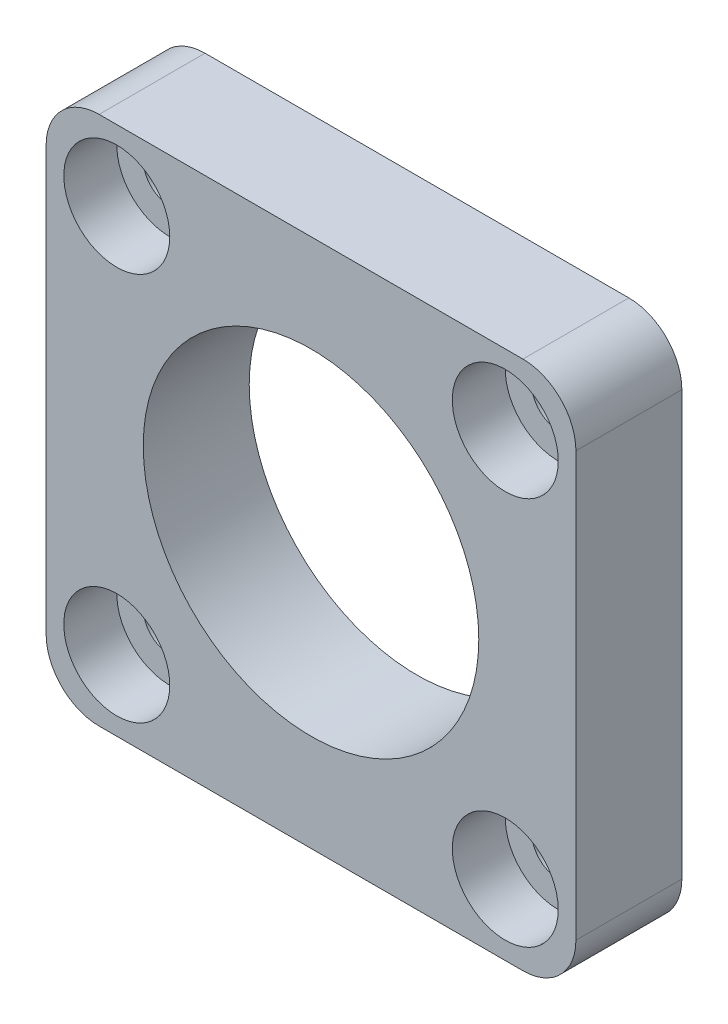
from build123d import *

# Parameters (mm, degrees)
SKETCH1_W           = 30
SKETCH1_H           = 30
SKETCH1_R           = 9.5
BOSS_EXTRUDE1_DEPTH = 6
SKETCH3_R           = 1.5
CUT_EXTRUDE2_DEPTH  = 23.045407685
SKETCH4_R           = 3
CUT_EXTRUDE3_DEPTH  = 3
FILLET1_R           = 3


with BuildPart() as part:
    # Sketch1 → Boss-Extrude1 (new body)
    with BuildSketch(Plane.XY):
        Rectangle(SKETCH1_W, SKETCH1_H)
        Circle(SKETCH1_R, mode=Mode.SUBTRACT)
    extrude(amount=BOSS_EXTRUDE1_DEPTH)

    # Sketch3 → Cut-Extrude2 (cut, through all)
    with BuildSketch(Plane.XY.offset(6)):
        with Locations((-11, 11)):
            Circle(SKETCH3_R)
        with Locations((11, 11)):
            Circle(SKETCH3_R)
        with Locations((11, -11)):
            Circle(SKETCH3_R)
        with Locations((-11, -11)):
            Circle(SKETCH3_R)
    extrude(amount=-CUT_EXTRUDE2_DEPTH, mode=Mode.SUBTRACT)

    # Sketch4 → Cut-Extrude3 (cut)
    with BuildSketch(Plane.XY.offset(6)):
        with Locations((-11, 11)):
            Circle(SKETCH4_R)
        with Locations((11, 11)):
            Circle(SKETCH4_R)
        with Locations((11, -11)):
            Circle(SKETCH4_R)
        with Locations((-11, -11)):
            Circle(SKETCH4_R)
    extrude(amount=-CUT_EXTRUDE3_DEPTH, mode=Mode.SUBTRACT)

    # Fillet1
    fillet1_edges = [part.edges().sort_by_distance(p)[0] for p in [
        (-15, -15, 3),
        (15, -15, 3),
        (15, 15, 3),
        (-15, 15, 3),
    ]]
    fillet(fillet1_edges, radius=FILLET1_R)


solid = part.part
